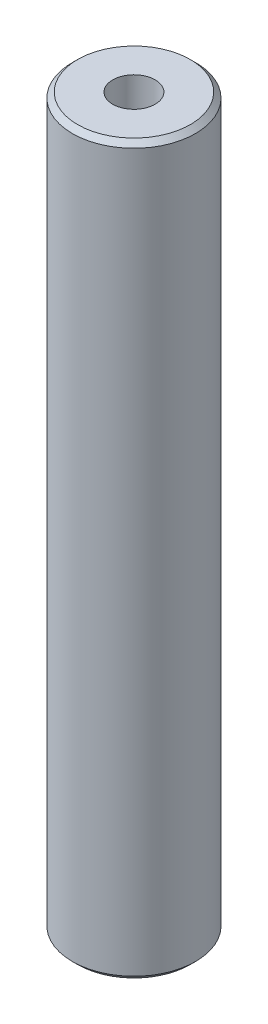
from build123d import *

# Parameters (mm, degrees)
SKETCH1_R           = 50
BOSS_EXTRUDE1_DEPTH = 590.68689406
SKETCH2_R           = 17.214499385
CUT_EXTRUDE1_DEPTH  = 595.904199694
CHAMFER1_SIZE       = 4.207010994


with BuildPart() as part:
    # Sketch1 → Boss-Extrude1 (new body)
    with BuildSketch(Plane(origin=(0, 0, 0), x_dir=(1, 0, 0), z_dir=(0, 1, 0))):
        Circle(SKETCH1_R)
    extrude(amount=BOSS_EXTRUDE1_DEPTH)

    # Sketch2 → Cut-Extrude1 (cut, through all)
    with BuildSketch(Plane(origin=(0, 0, 0), x_dir=(1, 0, 0), z_dir=(0, 1, 0))):
        Circle(SKETCH2_R)
    extrude(amount=CUT_EXTRUDE1_DEPTH, mode=Mode.SUBTRACT)

    # Chamfer1
    chamfer1_edges = [part.edges().sort_by_distance(p)[0] for p in [
        (-50, 590.68689406, 0),
        (-50, 0, 0),
    ]]
    chamfer(chamfer1_edges, length=CHAMFER1_SIZE)


solid = part.part
